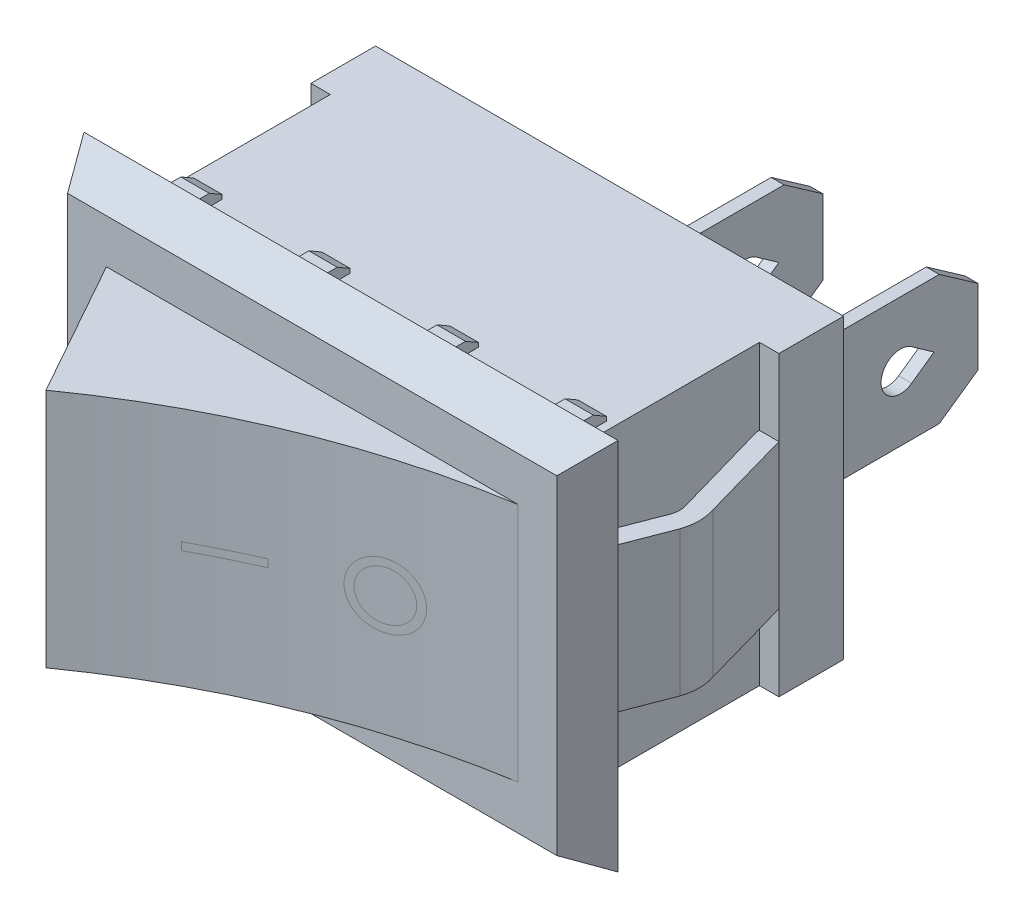
from build123d import *
from OCP.BRepFilletAPI import BRepFilletAPI_MakeChamfer

# Parameters (mm, degrees)
SKETCH1_W                       = 16.6
SKETCH1_H                       = 11.5
BOSS_EXTRUDE1_DEPTH             = 10
SKETCH2_W                       = 21
SKETCH2_H                       = 14.8
BOSS_EXTRUDE2_DEPTH             = 1.5
SKETCH3_W                       = 0.5
SKETCH3_H                       = 5
BOSS_EXTRUDE3_DEPTH             = 8
SKETCH4_W                       = 0.5
SKETCH4_H                       = 0.4
CUT_EXTRUDE1_DEPTH              = 22.623424798
BOSS_EXTRUDE4_REACH             = 19.241
SKETCH5_W                       = 0.75
SKETCH5_H                       = 2.5
BOSS_EXTRUDE4_DIRECTION_2_REACH = 19.241
BOSS_EXTRUDE5_DEPTH             = 2.8
CHAMFER1_SIZE                   = 1.8
CHAMFER1_SIZE_2                 = 1.039230485
BOSS_EXTRUDE6_DEPTH             = 4.65
SKETCH8_W                       = 1.1
SKETCH8_H                       = 0.45
BOSS_EXTRUDE7_DEPTH             = 1.9
CHAMFER2_SIZE                   = 0.5
CHAMFER2_SIZE2                  = 0.288675135
WRAP1_START                     = -10
WRAP1_DEPTH                     = 0.25


# Read off the part's stored shape, not the designer's step: Wrap1
with BuildPart() as part:
    # Sketch1 → Boss-Extrude1 (new body)
    with BuildSketch(Plane.XY):
        Rectangle(SKETCH1_W, SKETCH1_H)
    extrude(amount=BOSS_EXTRUDE1_DEPTH)

    # Sketch2 → Boss-Extrude2 (add)
    with BuildSketch(Plane.XY.offset(10)):
        Rectangle(SKETCH2_W, SKETCH2_H)
    extrude(amount=BOSS_EXTRUDE2_DEPTH)

    # Sketch3 → Boss-Extrude3 (add)
    with BuildSketch(Plane(origin=(0, 0, 0), x_dir=(-1, 0, 0), z_dir=(0, 0, -1))):
        Rectangle(SKETCH3_W, SKETCH3_H)
        with Locations((-6, 0)):
            Rectangle(SKETCH3_W, SKETCH3_H)
    extrude(amount=BOSS_EXTRUDE3_DEPTH)

    # Sketch4 → Cut-Extrude1 (cut, through all)
    with BuildSketch(Plane(origin=(6.25, 0, 0), x_dir=(0, 0, -1), z_dir=(1, 0, 0))):
        Polygon((6.5, 2.5), (8, 1.449688693), (8, 2.5), align=None)
        Polygon((8, -2.5), (8, -1.449688693), (6.5, -2.5), align=None)
        with Locations((2.25, -2.3)):
            Rectangle(SKETCH4_W, SKETCH4_H)
        with BuildLine():
            ThreePointArc((0, -0.75), (0.530330086, -0.530330086), (0.75, 0))
            Line((0.75, 0), (0, 0))
            Line((0, 0), (0, -0.75))
        make_face()
        with BuildLine():
            Line((0, 0), (0.75, 0))
            ThreePointArc((0.75, 0), (0.530330086, 0.530330086), (0, 0.75))
            Line((0, 0.75), (0, 0))
        make_face()
        with Locations((2.25, 2.3)):
            Rectangle(SKETCH4_W, SKETCH4_H)
        with BuildLine():
            Line((4.25, 0), (6.3, 0))
            Line((6.3, 0), (5.432692308, 0.612598863))
            ThreePointArc((5.432692308, 0.612598863), (4.655050171, 0.665965176), (4.25, 0))
        make_face()
        with BuildLine():
            Line((5.432692308, -0.612598863), (6.3, 0))
            Line((6.3, 0), (4.25, 0))
            ThreePointArc((4.25, 0), (4.655050171, -0.665965176), (5.432692308, -0.612598863))
        make_face()
    extrude(amount=-CUT_EXTRUDE1_DEPTH, mode=Mode.SUBTRACT)

    # Boss-Extrude4: up to this face of the body (flat: up to its plane)
    boss_extrude4_end = Plane(part.part.faces().sort_by_distance((0, 5.75, 5))[0])
    # Sketch5 → Boss-Extrude4 (add, up to the picked face)
    with BuildSketch(Plane(origin=(0, 0, 0), x_dir=(1, 0, 0), z_dir=(0, 1, 0)), mode=Mode.PRIVATE) as boss_extrude4_sk1:
        with Locations((-8.675, -1.25)):
            Rectangle(SKETCH5_W, SKETCH5_H)
    boss_extrude4_tool1 = split(extrude(boss_extrude4_sk1.sketch, amount=BOSS_EXTRUDE4_REACH, mode=Mode.PRIVATE), bisect_by=boss_extrude4_end, keep=Keep.BOTH, mode=Mode.PRIVATE)
    boss_extrude4 = boss_extrude4_tool1.solids().sort_by(Axis((-8.675, 0, 1.25), (0, 1, 0)))[0]
    add(boss_extrude4)

    # Boss-Extrude4 direction 2: up to this face of the body (flat: up to its plane)
    boss_extrude4_direction_2_end = Plane(part.part.faces().sort_by_distance((0, -5.75, 5))[0])
    # Sketch5 → Boss-Extrude4 direction 2 (add, up to the picked face)
    with BuildSketch(Plane(origin=(0, 0, 0), x_dir=(1, 0, 0), z_dir=(0, 1, 0)), mode=Mode.PRIVATE) as boss_extrude4_direction_2_sk1:
        with Locations((-8.675, -1.25)):
            Rectangle(SKETCH5_W, SKETCH5_H)
    boss_extrude4_direction_2_tool1 = split(extrude(boss_extrude4_direction_2_sk1.sketch, amount=-BOSS_EXTRUDE4_DIRECTION_2_REACH, mode=Mode.PRIVATE), bisect_by=boss_extrude4_direction_2_end, keep=Keep.BOTH, mode=Mode.PRIVATE)
    boss_extrude4_direction_2 = boss_extrude4_direction_2_tool1.solids().sort_by(Axis((-8.675, 0, 1.25), (0, -1, 0)))[0]
    add(boss_extrude4_direction_2)

    # Mirror1: Boss-Extrude4, Boss-Extrude4 direction 2 across plane
    add(boss_extrude4.mirror(Plane(origin=(0, 0, 0), x_dir=(0, 0, 1), z_dir=(1, 0, 0))))
    add(boss_extrude4_direction_2.mirror(Plane(origin=(0, 0, 0), x_dir=(0, 0, 1), z_dir=(1, 0, 0))))

    # Sketch6 → Boss-Extrude5 (add, symmetric)
    with BuildSketch(Plane(origin=(0, 0, 0), x_dir=(1, 0, 0), z_dir=(0, 1, 0))):
        with BuildLine():
            Line((-8.3, -2.5), (-9.05, -2.5))
            Line((-9.05, -2.5), (-10.056775734, -6.054415838))
            ThreePointArc((-10.056775734, -6.054415838), (-10.16130334, -6.692525863), (-10.056775734, -7.330635888))
            Line((-10.056775734, -7.330635888), (-9.03, -10))
            Line((-9.03, -10), (-8.3, -10))
            Line((-8.3, -10), (-8.3, -9.83))
            Line((-8.3, -9.83), (-9.324133061, -7.167955242))
            ThreePointArc((-9.324133061, -7.167955242), (-9.430562185, -6.777402526), (-9.37345004, -6.376657238))
            Line((-9.37345004, -6.376657238), (-8.3, -2.62))
            Line((-8.3, -2.62), (-8.3, -2.5))
        make_face()
    boss_extrude5 = extrude(amount=BOSS_EXTRUDE5_DEPTH, both=True)

    # Mirror2: Boss-Extrude5 across plane
    add(boss_extrude5.mirror(Plane(origin=(0, 0, 0), x_dir=(0, 0, 1), z_dir=(1, 0, 0))))

    # Chamfer1
    # the kernel refuses this chamfer: 1.8, 1.039230485 mm, written as the material it takes off along each edge
    with BuildSketch(Plane(origin=(-15.156754358, 7.4, 11.5), x_dir=(0, 0.019326765612700948, -0.9998132206222079), z_dir=(1, 0, 0))) as chamfer1_piece_1:
        Polygon((CHAMFER1_SIZE * 0.999813220622, -CHAMFER1_SIZE * 0.0193267656127), (-CHAMFER1_SIZE_2 * 0.0193267656042, -CHAMFER1_SIZE_2 * 0.999813220181), (0, 0), align=None)
    extrude(amount=30.313508717, mode=Mode.SUBTRACT)
    with BuildSketch(Plane(origin=(-10.5, -12.056754358, 11.5), x_dir=(-0.019326765612700473, 0, -0.9998132206222079), z_dir=(0, 1, 0)), Plane(origin=(10.5, 12.056754358, 11.5), x_dir=(0.019326765612700473, 0, -0.9998132206222079), z_dir=(0, -1, 0))) as chamfer1_piece_2:
        Polygon((CHAMFER1_SIZE * 0.999813220622, -CHAMFER1_SIZE * 0.0193267656127), (-CHAMFER1_SIZE_2 * 0.0193267656042, -CHAMFER1_SIZE_2 * 0.999813220181), (0, 0), align=None)
    extrude(amount=24.113508717, mode=Mode.SUBTRACT)
    with BuildSketch(Plane(origin=(15.156754358, -7.4, 11.5), x_dir=(0, 0.9983227437537925, 0.05789386240267112), z_dir=(-1, 0, 0))) as chamfer1_piece_3:
        Polygon((CHAMFER1_SIZE_2 * 0.998322743313, CHAMFER1_SIZE_2 * 0.0578938623771), (-CHAMFER1_SIZE * 0.0578938624027, CHAMFER1_SIZE * 0.998322743754), (0, 0), align=None)
    extrude(amount=30.313508717, mode=Mode.SUBTRACT)

    # Sketch7 → Boss-Extrude6 (add, symmetric)
    with BuildSketch(Plane(origin=(0, 0, 0), x_dir=(1, 0, 0), z_dir=(0, 1, 0))):
        with BuildLine():
            Line((-7.960769515, -11.5), (7.960769515, -11.5))
            ThreePointArc((7.960769515, -11.5), (1.177888648, -13.404715365), (-4.995235012, -16.8))
            Line((-4.995235012, -16.8), (-7.960769515, -11.5))
        make_face()
    extrude(amount=BOSS_EXTRUDE6_DEPTH, both=True)

    # Sketch8 → Boss-Extrude7 (add)
    with BuildSketch(Plane(origin=(0, 0, 10), x_dir=(-1, 0, 0), z_dir=(0, 0, -1))):
        with Locations((-2.48, 5.975)):
            Rectangle(SKETCH8_W, SKETCH8_H)
        with Locations((-2.48, -5.975)):
            Rectangle(SKETCH8_W, SKETCH8_H)
        with Locations((-7.43, 5.975)):
            Rectangle(SKETCH8_W, SKETCH8_H)
        with Locations((-7.43, -5.975)):
            Rectangle(SKETCH8_W, SKETCH8_H)
        with Locations((2.48, -5.975)):
            Rectangle(SKETCH8_W, SKETCH8_H)
        with Locations((7.43, -5.975)):
            Rectangle(SKETCH8_W, SKETCH8_H)
        with Locations((2.48, 5.975)):
            Rectangle(SKETCH8_W, SKETCH8_H)
        with Locations((7.43, 5.975)):
            Rectangle(SKETCH8_W, SKETCH8_H)
    extrude(amount=BOSS_EXTRUDE7_DEPTH)

    # Chamfer2: one chamfer whose edges measure the first distance from different faces: ONE call of the kernel's chamfer builder (chamfer() names one face for all edges)
    chamfer2_edges_1 = [part.edges().sort_by_distance(p)[0] for p in [
        (2.48, 6.2, 8.1),
    ]]
    chamfer2_side_1 = [part.faces().sort_by_distance(p)[0] for p in [
        (2.48, 6.2, 9.05),
    ]]
    chamfer2_edges_2 = [part.edges().sort_by_distance(p)[0] for p in [
        (7.43, 6.2, 8.1),
    ]]
    chamfer2_side_2 = [part.faces().sort_by_distance(p)[0] for p in [
        (7.43, 6.2, 9.05),
    ]]
    chamfer2_edges_3 = [part.edges().sort_by_distance(p)[0] for p in [
        (2.48, -6.2, 8.1),
    ]]
    chamfer2_side_3 = [part.faces().sort_by_distance(p)[0] for p in [
        (2.48, -6.2, 9.05),
    ]]
    chamfer2_edges_4 = [part.edges().sort_by_distance(p)[0] for p in [
        (7.43, -6.2, 8.1),
    ]]
    chamfer2_side_4 = [part.faces().sort_by_distance(p)[0] for p in [
        (7.43, -6.2, 9.05),
    ]]
    chamfer2_edges_5 = [part.edges().sort_by_distance(p)[0] for p in [
        (-2.48, -6.2, 8.1),
    ]]
    chamfer2_side_5 = [part.faces().sort_by_distance(p)[0] for p in [
        (-2.48, -6.2, 9.05),
    ]]
    chamfer2_edges_6 = [part.edges().sort_by_distance(p)[0] for p in [
        (-7.43, -6.2, 8.1),
    ]]
    chamfer2_side_6 = [part.faces().sort_by_distance(p)[0] for p in [
        (-7.43, -6.2, 9.05),
    ]]
    chamfer2_edges_7 = [part.edges().sort_by_distance(p)[0] for p in [
        (-2.48, 6.2, 8.1),
    ]]
    chamfer2_side_7 = [part.faces().sort_by_distance(p)[0] for p in [
        (-2.48, 6.2, 9.05),
    ]]
    chamfer2_edges_8 = [part.edges().sort_by_distance(p)[0] for p in [
        (-7.43, 6.2, 8.1),
    ]]
    chamfer2_side_8 = [part.faces().sort_by_distance(p)[0] for p in [
        (-7.43, 6.2, 9.05),
    ]]
    chamfer2 = BRepFilletAPI_MakeChamfer(part.part.solid().wrapped)
    for e in chamfer2_edges_1:
        chamfer2.Add(CHAMFER2_SIZE, CHAMFER2_SIZE2, e.wrapped, chamfer2_side_1[0].wrapped)  # the first distance lies on this face
    for e in chamfer2_edges_2:
        chamfer2.Add(CHAMFER2_SIZE, CHAMFER2_SIZE2, e.wrapped, chamfer2_side_2[0].wrapped)  # the first distance lies on this face
    for e in chamfer2_edges_3:
        chamfer2.Add(CHAMFER2_SIZE, CHAMFER2_SIZE2, e.wrapped, chamfer2_side_3[0].wrapped)  # the first distance lies on this face
    for e in chamfer2_edges_4:
        chamfer2.Add(CHAMFER2_SIZE, CHAMFER2_SIZE2, e.wrapped, chamfer2_side_4[0].wrapped)  # the first distance lies on this face
    for e in chamfer2_edges_5:
        chamfer2.Add(CHAMFER2_SIZE, CHAMFER2_SIZE2, e.wrapped, chamfer2_side_5[0].wrapped)  # the first distance lies on this face
    for e in chamfer2_edges_6:
        chamfer2.Add(CHAMFER2_SIZE, CHAMFER2_SIZE2, e.wrapped, chamfer2_side_6[0].wrapped)  # the first distance lies on this face
    for e in chamfer2_edges_7:
        chamfer2.Add(CHAMFER2_SIZE, CHAMFER2_SIZE2, e.wrapped, chamfer2_side_7[0].wrapped)  # the first distance lies on this face
    for e in chamfer2_edges_8:
        chamfer2.Add(CHAMFER2_SIZE, CHAMFER2_SIZE2, e.wrapped, chamfer2_side_8[0].wrapped)  # the first distance lies on this face
    add(Compound.cast(chamfer2.Shape()), mode=Mode.REPLACE)

    # Wrap1 outline → Wrap1 (add)
    # profile 1 of 10: a face of its own
    with BuildSketch(Plane(origin=(0, -15.75, 0), x_dir=(-1, 0, 0), z_dir=(0, -1, 0)).offset(WRAP1_START)):
        Polygon((-7.692528045, -1.079533921), (-7.001388889, 0), (-7.220602965, 0), (-7.801923077, -0.908233173), (-8.383243189, 0), (-8.602457265, 0), (-7.911742121, -1.079533921), (-8.575320513, -2.116666667), (-8.356106437, -2.116666667), (-7.801923077, -1.250834669), (-7.247739717, -2.116666667), (-7.028525641, -2.116666667), align=None)
    # profile 2 of 10: a face of its own
    with BuildSketch(Plane(origin=(0, -15.75, 0), x_dir=(-1, 0, 0), z_dir=(0, -1, 0)).offset(WRAP1_START)):
        Polygon((-5.901502404, -1.079533921), (-5.210363248, 0), (-5.429577324, 0), (-6.010897436, -0.908233173), (-6.592217548, 0), (-6.811431624, 0), (-6.12071648, -1.079533921), (-6.784294872, -2.116666667), (-6.565080796, -2.116666667), (-6.010897436, -1.250834669), (-5.456714076, -2.116666667), (-5.2375, -2.116666667), align=None)
    # profile 3 of 10: a face of its own
    with BuildSketch(Plane(origin=(0, -15.75, 0), x_dir=(-1, 0, 0), z_dir=(0, -1, 0)).offset(WRAP1_START)):
        Polygon((-4.110476763, -1.079533921), (-3.419337607, 0), (-3.638551683, 0), (-4.219871795, -0.908233173), (-4.801191907, 0), (-5.020405983, 0), (-4.329690839, -1.079533921), (-4.993269231, -2.116666667), (-4.774055155, -2.116666667), (-4.219871795, -1.250834669), (-3.665688435, -2.116666667), (-3.446474359, -2.116666667), align=None)
    # profile 4 of 10: a face of its own
    with BuildSketch(Plane(origin=(0, -15.75, 0), x_dir=(-1, 0, 0), z_dir=(0, -1, 0)).offset(WRAP1_START)):
        Polygon((-2.319451122, -1.079533921), (-1.628311966, 0), (-1.847526042, 0), (-2.428846154, -0.908233173), (-3.010166266, 0), (-3.229380342, 0), (-2.538665198, -1.079533921), (-3.20224359, -2.116666667), (-2.983029514, -2.116666667), (-2.428846154, -1.250834669), (-1.874662794, -2.116666667), (-1.655448718, -2.116666667), align=None)
    # profile 5 of 10: a face of its own
    with BuildSketch(Plane(origin=(0, -15.75, 0), x_dir=(-1, 0, 0), z_dir=(0, -1, 0)).offset(WRAP1_START)):
        Polygon((-0.528425481, -1.079533921), (0.162713675, 0), (-0.056500401, 0), (-0.637820513, -0.908233173), (-1.219140625, 0), (-1.438354701, 0), (-0.747639557, -1.079533921), (-1.411217949, -2.116666667), (-1.192003873, -2.116666667), (-0.637820513, -1.250834669), (-0.083637153, -2.116666667), (0.135576923, -2.116666667), align=None)
    # profile 6 of 10: a face of its own
    with BuildSketch(Plane(origin=(0, -15.75, 0), x_dir=(-1, 0, 0), z_dir=(0, -1, 0)).offset(WRAP1_START)):
        Polygon((1.26260016, -1.079533921), (1.953739316, 0), (1.73452524, 0), (1.153205128, -0.908233173), (0.571885016, 0), (0.35267094, 0), (1.043386084, -1.079533921), (0.379807692, -2.116666667), (0.599021768, -2.116666667), (1.153205128, -1.250834669), (1.707388488, -2.116666667), (1.926602564, -2.116666667), align=None)
    # profile 7 of 10: a face of its own
    with BuildSketch(Plane(origin=(0, -15.75, 0), x_dir=(-1, 0, 0), z_dir=(0, -1, 0)).offset(WRAP1_START)):
        with BuildLine():
            add(Edge.make_bspline(
                [(3.144734, 0), (3.152605931, -0.003647564), (3.174943766, -0.014626103), (3.210995132, -0.034820842), (3.252297529, -0.061905788), (3.291612235, -0.092945747), (3.32917361, -0.127270043), (3.363998512, -0.16576325), (3.396601223, -0.207810987), (3.427114657, -0.253329551), (3.455747577, -0.302177583), (3.481335055, -0.354950536), (3.505447121, -0.41124275), (3.526702092, -0.472432365), (3.54526154, -0.53897765), (3.560908843, -0.611332504), (3.573372138, -0.689500393), (3.583582357, -0.773360306), (3.590635278, -0.863045878), (3.594926962, -0.958365012), (3.595313971, -1.023842285), (3.595512821, -1.05748531)],
                knots=[0.178568164, 0.178568164, 0.178568164, 0.178568164, 0.196131023, 0.228932781, 0.262192061, 0.296028766, 0.330258969, 0.365104594, 0.400999259, 0.437909837, 0.476000968, 0.515551117, 0.556588259, 0.599944081, 0.646608288, 0.696400862, 0.749756516, 0.806838353, 0.867421666, 0.931879629, 1, 1, 1, 1], degree=3))
            Line((3.144734, 0), (2.629511338, 0))
            add(Edge.make_bspline(
                [(2.157264957, -1.05748531), (2.157664, -1.025116493), (2.158443258, -0.961905996), (2.162359106, -0.8696552), (2.170293842, -0.782583289), (2.179964851, -0.700564111), (2.193908553, -0.62370488), (2.209432061, -0.551592833), (2.229233166, -0.484905548), (2.251136766, -0.422897256), (2.276436092, -0.365623354), (2.30349625, -0.311819284), (2.333322138, -0.261818529), (2.36482592, -0.215090446), (2.399096373, -0.172488339), (2.435190003, -0.133205132), (2.473722159, -0.097550214), (2.514642315, -0.065827545), (2.556793266, -0.037244784), (2.595541981, -0.016063028), (2.619974526, -0.004301795), (2.629511338, 0)],
                knots=[0, 0, 0, 0, 0.065059634, 0.127049804, 0.185506124, 0.240751935, 0.292964118, 0.342446011, 0.388918242, 0.43267545, 0.474525867, 0.51466987, 0.55364305, 0.591461438, 0.627838851, 0.663418981, 0.698597706, 0.733202915, 0.767395276, 0.800834807, 0.821858786, 0.821858786, 0.821858786, 0.821858786], degree=3))
            add(Edge.make_bspline(
                [(2.887837206, -2.170940171), (2.870995205, -2.170706582), (2.837485551, -2.170241821), (2.788121771, -2.16370004), (2.739617824, -2.155256373), (2.69270961, -2.141714123), (2.646510186, -2.125509064), (2.602168438, -2.104126746), (2.558118868, -2.080871814), (2.516362589, -2.052502754), (2.475652, -2.021150274), (2.437490074, -1.985557194), (2.400901288, -1.946708556), (2.367267589, -1.903737923), (2.335147481, -1.85730416), (2.305760277, -1.80701802), (2.278494777, -1.752990944), (2.25283846, -1.695473393), (2.230402689, -1.632928984), (2.210455496, -1.565747823), (2.194105395, -1.493321553), (2.180584149, -1.416053634), (2.170089089, -1.333561281), (2.162450961, -1.246011633), (2.158414875, -1.153349918), (2.157654934, -1.089996342), (2.157264957, -1.05748531)],
                knots=[0, 0, 0, 0, 0.033787941, 0.067226111, 0.099841381, 0.132545412, 0.165129805, 0.198010643, 0.231279811, 0.26504391, 0.299215764, 0.33435884, 0.369695008, 0.406257575, 0.443803519, 0.482981531, 0.523084852, 0.565266777, 0.609342883, 0.656392591, 0.705887018, 0.758325752, 0.813832747, 0.872795218, 0.934722568, 1, 1, 1, 1], degree=3))
            add(Edge.make_bspline(
                [(3.595512821, -1.05748531), (3.595314448, -1.091410873), (3.594929105, -1.157311768), (3.590642298, -1.253338671), (3.58352102, -1.343424179), (3.57376175, -1.427572603), (3.561885454, -1.505805676), (3.546031305, -1.577914294), (3.528001731, -1.644232317), (3.50710548, -1.704975606), (3.483528005, -1.760963884), (3.457862367, -1.813227697), (3.429107678, -1.861704613), (3.39884534, -1.907108879), (3.366016227, -1.948983561), (3.330734503, -1.987140467), (3.293310931, -2.022170894), (3.253568435, -2.053498812), (3.211885809, -2.080796914), (3.169496081, -2.105542026), (3.125190207, -2.125116092), (3.080061017, -2.141854173), (3.033744915, -2.155112995), (2.986221725, -2.164335547), (2.937448801, -2.170105371), (2.904531302, -2.170659264), (2.887837206, -2.170940171)],
                knots=[0, 0, 0, 0, 0.068593875, 0.133244592, 0.194310471, 0.251276487, 0.304510124, 0.35423105, 0.400476228, 0.443405927, 0.484009599, 0.523246604, 0.561036264, 0.59789373, 0.633511591, 0.668500186, 0.702875322, 0.737064632, 0.770672082, 0.803567221, 0.836183096, 0.868461678, 0.900847618, 0.933467249, 0.966257943, 1, 1, 1, 1], degree=3))
        make_face()
        with BuildLine():
            add(Edge.make_bspline(
                [(2.88147703, -0.162820513), (2.858053703, -0.163841746), (2.811290138, -0.165880591), (2.742610872, -0.183674823), (2.67648833, -0.212602594), (2.624305121, -0.245651886), (2.58471523, -0.277327315), (2.55633926, -0.304302526), (2.53029763, -0.334515607), (2.505597717, -0.367111382), (2.482943946, -0.402715348), (2.462343843, -0.441155535), (2.443545823, -0.482538905), (2.432836066, -0.511428222), (2.427360443, -0.526198584)],
                knots=[0, 0, 0, 0, 0.112801787, 0.225203442, 0.3396628, 0.459731034, 0.521784425, 0.583968672, 0.648210364, 0.713910493, 0.781027, 0.85146622, 0.924058511, 1, 1, 1, 1], degree=3))
            add(Edge.make_bspline(
                [(3.405555556, -1.058333333), (3.405481735, -1.030061614), (3.405338462, -0.975191759), (3.401703899, -0.895597337), (3.396644958, -0.821234886), (3.390280518, -0.75213343), (3.380748871, -0.68853447), (3.369934609, -0.630173629), (3.356963647, -0.577158839), (3.341540718, -0.529027124), (3.323973429, -0.485095872), (3.304823526, -0.444197786), (3.284080043, -0.405835402), (3.261267061, -0.370147132), (3.236057737, -0.337332302), (3.209014751, -0.307235066), (3.179980856, -0.27997797), (3.139798004, -0.24762932), (3.087007212, -0.213807642), (3.020152952, -0.184717784), (2.951426907, -0.166318501), (2.904766624, -0.163985157), (2.88147703, -0.162820513)],
                knots=[0, 0, 0, 0, 0.072959673, 0.141600398, 0.205586825, 0.265331751, 0.320634151, 0.371501035, 0.418479844, 0.461393865, 0.501833489, 0.540508785, 0.577889404, 0.614316312, 0.649701864, 0.684570341, 0.718633852, 0.752359742, 0.817630925, 0.879707886, 0.939958477, 1, 1, 1, 1], degree=3))
            add(Edge.make_bspline(
                [(2.88147703, -1.953846154), (2.904892262, -1.952628157), (2.951765383, -1.950189945), (3.020854591, -1.932691745), (3.087314611, -1.903163137), (3.139931892, -1.869760016), (3.179966453, -1.837667677), (3.208455762, -1.810277545), (3.235342234, -1.78046178), (3.260430792, -1.747795735), (3.283104585, -1.712175515), (3.304100187, -1.674091236), (3.323097306, -1.633253903), (3.340730905, -1.589346931), (3.355990187, -1.541136127), (3.369710062, -1.488131909), (3.38029974, -1.429391523), (3.389702444, -1.365493902), (3.396809819, -1.29631029), (3.401668641, -1.221771805), (3.405349502, -1.141899922), (3.405485495, -1.086746771), (3.405555556, -1.058333333)],
                knots=[0, 0, 0, 0, 0.060388995, 0.120888004, 0.182614396, 0.247364982, 0.281081942, 0.314871796, 0.349216002, 0.384592185, 0.421009447, 0.458060289, 0.496725344, 0.53715426, 0.580056919, 0.627112401, 0.678324151, 0.733972755, 0.793738591, 0.857708075, 0.926694981, 1, 1, 1, 1], degree=3))
            add(Edge.make_bspline(
                [(2.347222222, -1.058333333), (2.347488211, -1.083777767), (2.348008606, -1.133558677), (2.351427651, -1.206388192), (2.356921771, -1.275681413), (2.364357943, -1.3415012), (2.374566232, -1.403730404), (2.386825378, -1.462458065), (2.401197798, -1.51766838), (2.417683469, -1.569503632), (2.436262326, -1.617777855), (2.456787306, -1.662594965), (2.478687081, -1.704196682), (2.50248907, -1.742449199), (2.527856516, -1.777575718), (2.555700275, -1.808767652), (2.584251732, -1.837542399), (2.624857946, -1.86980101), (2.677586343, -1.90295206), (2.743650872, -1.932629776), (2.81202481, -1.950193849), (2.858342982, -1.952629597), (2.88147703, -1.953846154)],
                knots=[0, 0, 0, 0, 0.065676417, 0.128493004, 0.188147213, 0.245074069, 0.299412408, 0.350856965, 0.399878556, 0.446605218, 0.491184762, 0.533303507, 0.573776971, 0.612447713, 0.649515839, 0.685448128, 0.720274427, 0.754003849, 0.819086864, 0.880502161, 0.940315679, 1, 1, 1, 1], degree=3))
            add(Edge.make_bspline(
                [(2.427360443, -0.526198584), (2.420979136, -0.545085141), (2.408022346, -0.583432951), (2.391323797, -0.642919541), (2.378173008, -0.705332641), (2.366341829, -0.770299259), (2.35826641, -0.838298507), (2.351766542, -0.909119986), (2.347937983, -0.982817096), (2.347463396, -1.032888352), (2.347222222, -1.058333333)],
                knots=[0, 0, 0, 0, 0.110588339, 0.224541754, 0.342503494, 0.464324098, 0.590756033, 0.722227475, 0.858842836, 1, 1, 1, 1], degree=3))
        make_face(mode=Mode.SUBTRACT)
    # profile 8 of 10: a face of its own
    with BuildSketch(Plane(origin=(0, -15.75, 0), x_dir=(-1, 0, 0), z_dir=(0, -1, 0)).offset(WRAP1_START)):
        Polygon((8.778632479, 0), (7.584615385, 0), (7.584615385, -0.217094017), (8.588675214, -0.217094017), (8.588675214, -1.031196581), (7.584615385, -1.031196581), (7.584615385, -1.248290598), (8.588675214, -1.248290598), (8.588675214, -1.89957265), (7.584615385, -1.89957265), (7.584615385, -2.116666667), (8.778632479, -2.116666667), align=None)
    # profile 9 of 10: a face of its own
    with BuildSketch(Plane(origin=(0, -15.75, 0), x_dir=(-1, 0, 0), z_dir=(0, -1, 0)).offset(WRAP1_START)):
        Polygon((5.619744925, 0), (5.576495726, 0), (5.576495726, -2.116666667), (5.766452991, -2.116666667), (5.766452991, -0.450724493), (7.16484375, -2.116666667), (7.204700855, -2.116666667), (7.204700855, 0), (7.01474359, 0), (7.01474359, -1.662126068), align=None)
    # profile 10 of 10: a face of its own
    with BuildSketch(Plane(origin=(0, -15.75, 0), x_dir=(-1, 0, 0), z_dir=(0, -1, 0)).offset(WRAP1_START)):
        with BuildLine():
            add(Edge.make_bspline(
                [(5.142307692, -1.465384615), (5.141069863, -1.490585705), (5.138638799, -1.540079975), (5.127249185, -1.61224077), (5.110967161, -1.681223129), (5.087891734, -1.746435655), (5.059395598, -1.808657366), (5.024508081, -1.867062031), (4.983972929, -1.922229307), (4.937864505, -1.973114697), (4.887832615, -2.019630305), (4.834177028, -2.060223989), (4.777449222, -2.094129271), (4.71814123, -2.122627442), (4.655567138, -2.143992806), (4.590325084, -2.159852519), (4.52212018, -2.169392944), (4.475650314, -2.17041856), (4.45201656, -2.170940171)],
                knots=[0, 0, 0, 0, 0.068798517, 0.135118456, 0.199001011, 0.261933701, 0.323531284, 0.385434721, 0.447215516, 0.510018103, 0.57251091, 0.633364022, 0.693216728, 0.752555388, 0.812558227, 0.873260859, 0.935542708, 1, 1, 1, 1], degree=3))
            Line((5.142307692, -1.465384615), (4.952350427, -1.465384615))
            add(Edge.make_bspline(
                [(4.46176883, -1.953846154), (4.478325895, -1.953430924), (4.510841238, -1.95261548), (4.558478372, -1.94643509), (4.604240718, -1.937075206), (4.64742309, -1.922174346), (4.688929219, -1.904734837), (4.727700262, -1.88215374), (4.764825347, -1.856351345), (4.799558063, -1.826267391), (4.831192062, -1.792307138), (4.859969793, -1.755342003), (4.884353451, -1.714716669), (4.905998577, -1.671405952), (4.922552826, -1.624219928), (4.936705522, -1.57431259), (4.946985835, -1.520971876), (4.95053253, -1.484221452), (4.952350427, -1.465384615)],
                knots=[0, 0, 0, 0, 0.06444202, 0.126553487, 0.186778822, 0.245943975, 0.304110346, 0.361785279, 0.420255407, 0.479942859, 0.540286236, 0.600712357, 0.66196223, 0.724472194, 0.788881313, 0.856306291, 0.926348201, 1, 1, 1, 1], degree=3))
            add(Edge.make_bspline(
                [(4.002564103, -1.524746261), (4.002944626, -1.539190417), (4.003694565, -1.567657074), (4.010438504, -1.609366229), (4.02034669, -1.649755574), (4.035618264, -1.688325723), (4.053966499, -1.725835277), (4.077407722, -1.761143828), (4.104194884, -1.795454961), (4.135266679, -1.827592174), (4.169377735, -1.857034851), (4.205419238, -1.883114097), (4.243549233, -1.904909324), (4.283608818, -1.922776066), (4.325485817, -1.936791665), (4.36926136, -1.946503279), (4.414814454, -1.952600782), (4.445919473, -1.953425781), (4.46176883, -1.953846154)],
                knots=[0, 0, 0, 0, 0.061969039, 0.122129076, 0.180999124, 0.240162417, 0.299864723, 0.359951267, 0.421741789, 0.486545679, 0.551508471, 0.614994937, 0.677239666, 0.73971468, 0.803038538, 0.866487293, 0.93196948, 1, 1, 1, 1], degree=3))
            add(Edge.make_bspline(
                [(4.402831197, -0.87600828), (4.382843679, -0.896870404), (4.344451747, -0.936942274), (4.290173281, -0.995463701), (4.241344074, -1.04969109), (4.197931734, -1.099864735), (4.159900541, -1.145700197), (4.127372179, -1.187556678), (4.100202878, -1.225074979), (4.071409081, -1.26914991), (4.043952285, -1.323026654), (4.019820571, -1.38853567), (4.005211559, -1.456121195), (4.003450121, -1.501779661), (4.002564103, -1.524746261)],
                knots=[0, 0, 0, 0, 0.110794173, 0.212812933, 0.30607791, 0.390617458, 0.467232727, 0.534450618, 0.593866801, 0.644832969, 0.736220619, 0.825037402, 0.911992313, 1, 1, 1, 1], degree=3))
            Line((4.402831197, -0.87600828), (5.223717949, 0))
            Line((5.223717949, 0), (3.785470085, 0))
            Line((3.785470085, 0), (3.785470085, -0.217094017))
            Line((3.785470085, -0.217094017), (4.770449386, -0.217094017))
            Line((4.770449386, -0.217094017), (4.240858707, -0.782301683))
            add(Edge.make_bspline(
                [(3.812606838, -1.541706731), (3.813630875, -1.51222591), (3.815660978, -1.453781616), (3.833026103, -1.367896251), (3.860148463, -1.284685701), (3.892801113, -1.217713716), (3.925750449, -1.163753807), (3.955412888, -1.119303949), (3.990335161, -1.071455997), (4.030218909, -1.020016286), (4.075750985, -0.965658464), (4.125748474, -0.907273485), (4.181502576, -0.845940926), (4.220599606, -0.804022672), (4.240858707, -0.782301683)],
                knots=[0, 0, 0, 0, 0.098701375, 0.19567068, 0.292419993, 0.391339287, 0.444458742, 0.504224579, 0.570347591, 0.642913826, 0.722289817, 0.807922721, 0.900470366, 1, 1, 1, 1], degree=3))
            add(Edge.make_bspline(
                [(4.45201656, -2.170940171), (4.428805329, -2.170401228), (4.38319609, -2.169342225), (4.316657883, -2.160111035), (4.253164476, -2.145965059), (4.193435438, -2.125002951), (4.136857782, -2.098700091), (4.084132034, -2.065989039), (4.03398323, -2.028417571), (3.988872585, -1.984100183), (3.947433016, -1.936813417), (3.911714612, -1.886311549), (3.880953642, -1.834091062), (3.855776749, -1.779744039), (3.836691545, -1.723093499), (3.822551237, -1.664682571), (3.814467873, -1.603837152), (3.813234098, -1.562647717), (3.812606838, -1.541706731)],
                knots=[0, 0, 0, 0, 0.069479636, 0.136525004, 0.200800893, 0.263983207, 0.325711145, 0.387270514, 0.449492781, 0.512955196, 0.576266397, 0.637574967, 0.697901098, 0.757558279, 0.816587504, 0.876645757, 0.937285873, 1, 1, 1, 1], degree=3))
        make_face()
    extrude(amount=WRAP1_DEPTH)


solid = part.part
